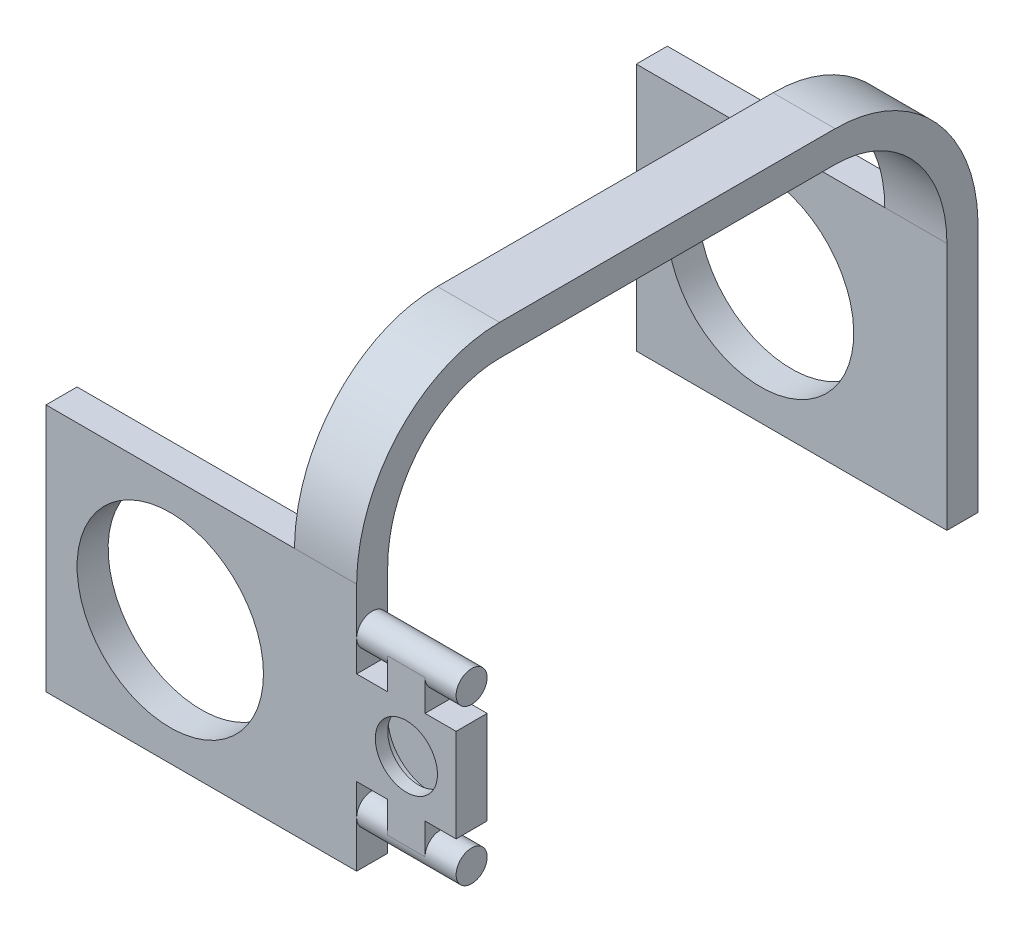
from build123d import *

# Parameters (mm, degrees)
SKETCH1_W            = 10
SKETCH1_H            = 54
BOSS_EXTRUDE1_DEPTH  = 5
SWEEP1_START         = -10
SWEEP1_DEPTH         = 10
SKETCH21_W           = 5
SKETCH21_H           = 40
BOSS_EXTRUDE13_DEPTH = 50
CUT_EXTRUDE5_REACH   = 111.677
SKETCH22_R           = 15
SKETCH23_W           = 5
SKETCH23_H           = 7.5
BOSS_EXTRUDE14_DEPTH = 16
SKETCH25_W           = 6
SKETCH25_H           = 5
BOSS_EXTRUDE15_DEPTH = 5
BOSS_EXTRUDE16_START = -11
SKETCH26_R           = 2.5
BOSS_EXTRUDE16_DEPTH = 16
SKETCH27_R           = 5
CUT_EXTRUDE6_DEPTH   = 2
SKETCH28_R           = 7
CUT_EXTRUDE7_DEPTH   = 2


# Read off the part's stored shape, not the designer's step: Sweep1
with BuildPart() as part:
    # Sketch1 → Boss-Extrude1 (new body)
    with BuildSketch(Plane(origin=(0, 0, 0), x_dir=(1, 0, 0), z_dir=(0, 1, 0))):
        with Locations((-5, 0)):
            Rectangle(SKETCH1_W, SKETCH1_H)
    extrude(amount=BOSS_EXTRUDE1_DEPTH)

    # Sweep1 outline → Sweep1 (add)
    with BuildSketch(Plane.YZ.offset(SWEEP1_START)):
        with BuildLine():
            add(Edge.make_bspline(
                [(0, 27), (0, 27.950351514), (-0.172434752, 29.918217718), (-0.796149749, 32.167991271), (-1.302869422, 33.395267281), (-1.739516744, 34.387921089), (-2.661753815, 36.119188434), (-4.22896336, 38.158838586), (-5.451719113, 39.362391324), (-6.326493526, 40.149688296), (-8.022611605, 41.526323583), (-10.352976461, 42.852067259), (-12.211369714, 43.584142584), (-13.655707265, 44.098762642), (-16.151123616, 44.773184518), (-18.617213406, 45), (-20, 45)],
                knots=[0, 0, 0, 0, 0.112, 0.224, 0.25, 0.25, 0.336, 0.448, 0.5, 0.5, 0.56, 0.706666667, 0.75, 0.75, 0.853333333, 1, 1, 1, 1], degree=3))
            Line((0, 27), (5, 27))
            add(Edge.make_bspline(
                [(5, 27), (4.984411288, 28.251059427), (4.780799112, 30.820341459), (3.964215769, 33.744214746), (3.303741608, 35.338710661), (2.735705426, 36.627402848), (1.54258269, 38.870356963), (-0.443543492, 41.451963332), (-1.998072761, 42.979180099), (-3.10651281, 43.976727473), (-5.248892104, 45.718354902), (-8.128272447, 47.350097628), (-10.42650043, 48.255788258), (-12.211760541, 48.893040013), (-15.29398957, 49.730208062), (-18.300289893, 49.984109545), (-20, 50)],
                knots=[0, 0, 0, 0, 0.112, 0.224, 0.25, 0.25, 0.336, 0.448, 0.5, 0.5, 0.56, 0.706666667, 0.75, 0.75, 0.853333333, 1, 1, 1, 1], degree=3))
            Line((-20, 50), (-20, 45))
        make_face()
    sweep1 = extrude(amount=SWEEP1_DEPTH)

    # Sketch21 → Boss-Extrude13 (add)
    with BuildSketch(Plane(origin=(0, 0, 0), x_dir=(0, 0, -1), z_dir=(1, 0, 0))):
        with Locations((-47.5, -40)):
            Rectangle(SKETCH21_W, SKETCH21_H)
    boss_extrude13 = extrude(amount=-BOSS_EXTRUDE13_DEPTH)

    # Sketch22 → Cut-Extrude5 (cut, up to next)
    with BuildSketch(Plane.XY.offset(50), mode=Mode.PRIVATE) as cut_extrude5_sk1:
        with Locations((-30, -40)):
            Circle(SKETCH22_R)
    cut_extrude5_tool1 = extrude(cut_extrude5_sk1.sketch, amount=-CUT_EXTRUDE5_REACH, mode=Mode.PRIVATE) & part.part
    cut_extrude5 = cut_extrude5_tool1.solids().sort_by_distance((-30, -40, 50))[0]
    add(cut_extrude5, mode=Mode.SUBTRACT)

    # Sketch23 → Boss-Extrude14 (add)
    with BuildSketch(Plane(origin=(0, 0, 0), x_dir=(0, 0, -1), z_dir=(1, 0, 0))):
        with Locations((-47.5, -43.75)):
            Rectangle(SKETCH23_W, SKETCH23_H)
    boss_extrude14 = extrude(amount=BOSS_EXTRUDE14_DEPTH)

    # Sketch25 → Boss-Extrude15 (add)
    with BuildSketch(Plane.XZ.offset(47.5)):
        with Locations((8, 47.5)):
            Rectangle(SKETCH25_W, SKETCH25_H)
    boss_extrude15 = extrude(amount=BOSS_EXTRUDE15_DEPTH)

    # Sketch26 → Boss-Extrude16 (add)
    with BuildSketch(Plane(origin=(11, 0, 0), x_dir=(0, 0, -1), z_dir=(1, 0, 0)).offset(BOSS_EXTRUDE16_START)):
        with Locations((-47.5, -52.5)):
            Circle(SKETCH26_R)
    boss_extrude16 = extrude(amount=BOSS_EXTRUDE16_DEPTH)

    # Mirror2: Boss-Extrude14, Boss-Extrude15, Boss-Extrude16 across plane
    add(boss_extrude14.mirror(Plane(origin=(16, -40, 45), x_dir=(0, 0, 1), z_dir=(0, -1, 0))))
    add(boss_extrude15.mirror(Plane(origin=(16, -40, 45), x_dir=(0, 0, 1), z_dir=(0, -1, 0))))
    add(boss_extrude16.mirror(Plane(origin=(16, -40, 45), x_dir=(0, 0, 1), z_dir=(0, -1, 0))))

    # Sketch27 → Cut-Extrude6 (cut)
    with BuildSketch(Plane.XY.offset(50)):
        with Locations((8, -40)):
            Circle(SKETCH27_R)
    extrude(amount=-CUT_EXTRUDE6_DEPTH, mode=Mode.SUBTRACT)

    # Sketch28 → Cut-Extrude7 (cut)
    with BuildSketch(Plane.XY.offset(48)):
        with Locations((8, -40)):
            Circle(SKETCH28_R)
    extrude(amount=-CUT_EXTRUDE7_DEPTH, mode=Mode.SUBTRACT)

    # Mirror3: Sweep1, Boss-Extrude13, Cut-Extrude5 across plane
    add(sweep1.mirror(Plane.XY))
    add(boss_extrude13.mirror(Plane.XY))
    add(cut_extrude5.mirror(Plane.XY), mode=Mode.SUBTRACT)


solid = part.part
